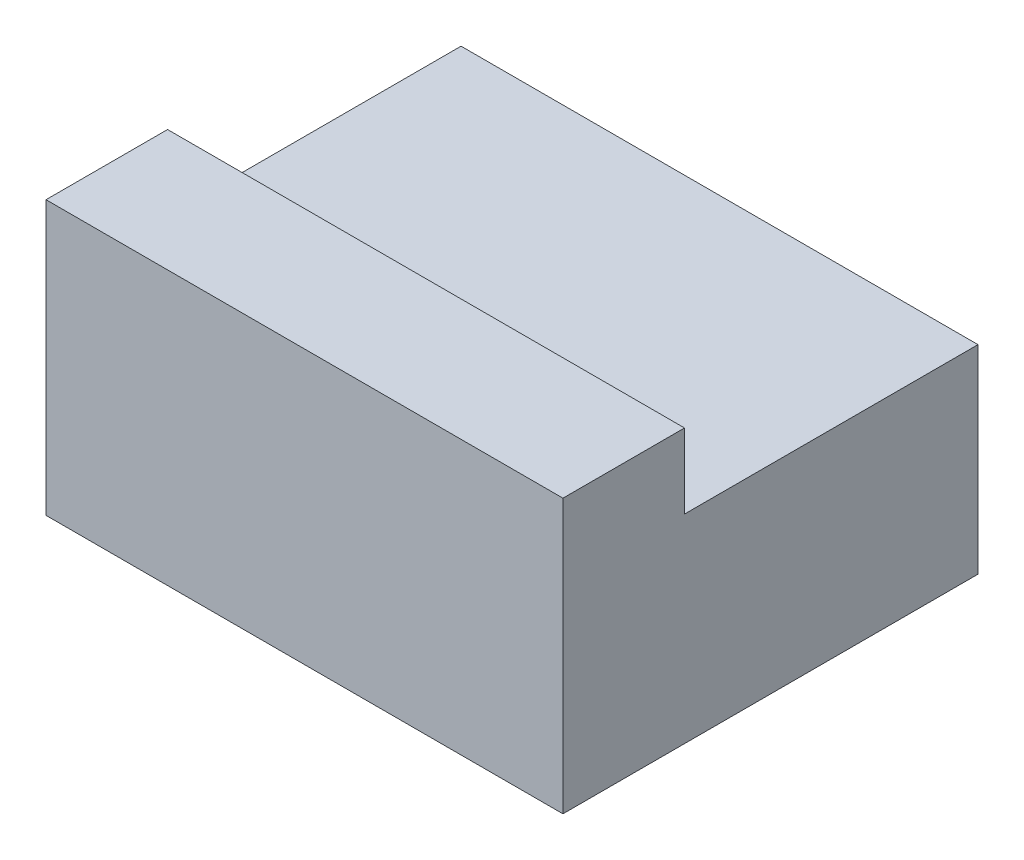
from build123d import *

# Parameters (mm, degrees)
SKETCH1_W           = 104
SKETCH1_H           = 83.5
BOSS_EXTRUDE1_DEPTH = 55
SKETCH2_W           = 59.042208754
SKETCH2_H           = 15
CUT_EXTRUDE1_DEPTH  = 145.267979815


with BuildPart() as part:
    # Sketch1 → Boss-Extrude1 (new body)
    with BuildSketch(Plane(origin=(0, 0, 0), x_dir=(1, 0, 0), z_dir=(0, 1, 0))):
        with Locations((52, 41.75)):
            Rectangle(SKETCH1_W, SKETCH1_H)
    extrude(amount=BOSS_EXTRUDE1_DEPTH)

    # Sketch2 → Cut-Extrude1 (cut, through all)
    with BuildSketch(Plane(origin=(104, 0, 0), x_dir=(0, 0, -1), z_dir=(1, 0, 0))):
        with Locations((53.978895623, 47.5)):
            Rectangle(SKETCH2_W, SKETCH2_H)
    extrude(amount=-CUT_EXTRUDE1_DEPTH, mode=Mode.SUBTRACT)


solid = part.part
